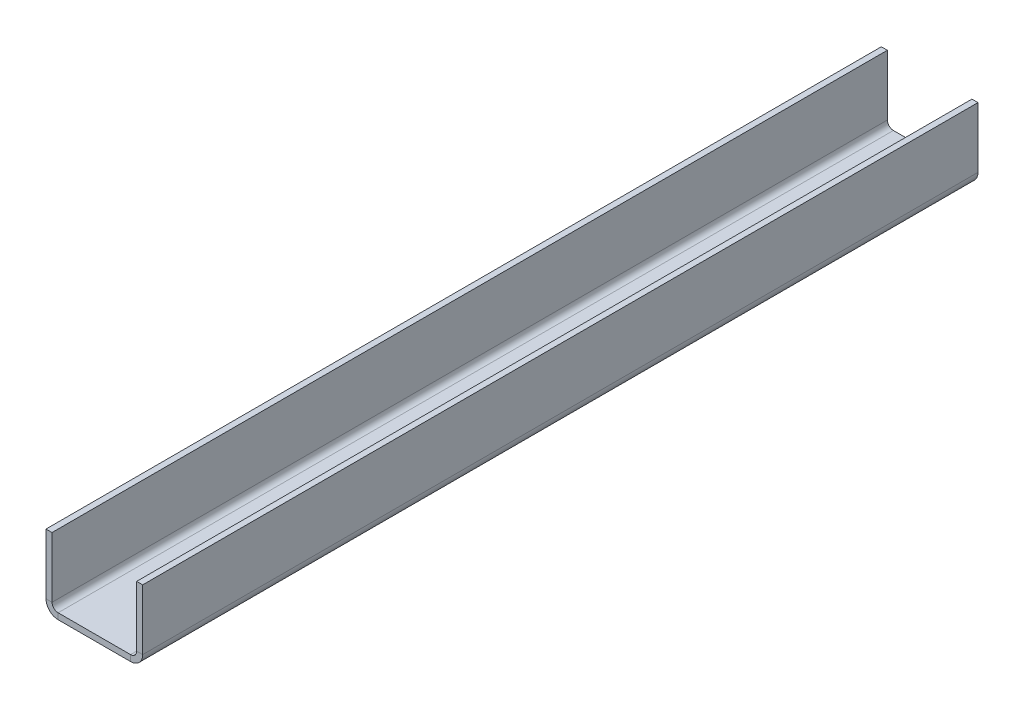
from build123d import *

# Parameters (mm, degrees)
BASE_FLANGE1_DEPTH = 438.912


# Sheet-metal steps are written as plain solids
with BuildPart() as part:
    # Sketch1 → Base-Flange1 (new body)
    with BuildSketch(Plane.XY):
        with BuildLine():
            Line((50.8, 38.1), (50.8, 6.35))
            ThreePointArc((50.8, 6.35), (48.940128061, 1.859871939), (44.45, 0))
            Line((44.45, 0), (6.35, 0))
            ThreePointArc((6.35, 0), (1.859871939, 1.859871939), (0, 6.35))
            Line((0, 6.35), (0, 38.1))
            Line((0, 38.1), (3.175, 38.1))
            Line((3.175, 38.1), (3.175, 6.35))
            ThreePointArc((3.175, 6.35), (4.10493597, 4.10493597), (6.35, 3.175))
            Line((6.35, 3.175), (44.45, 3.175))
            ThreePointArc((44.45, 3.175), (46.69506403, 4.10493597), (47.625, 6.35))
            Line((47.625, 6.35), (47.625, 38.1))
            Line((47.625, 38.1), (50.8, 38.1))
        make_face()
    extrude(amount=BASE_FLANGE1_DEPTH)


solid = part.part
